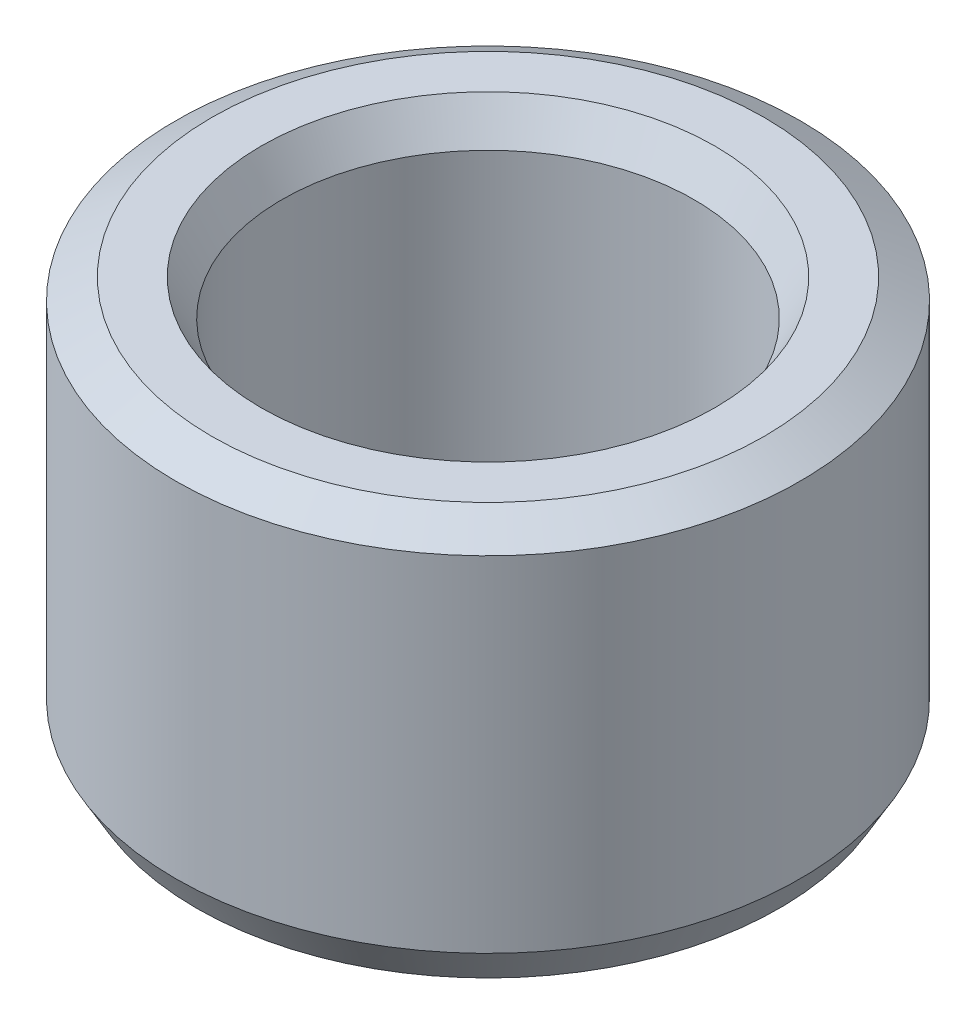
from build123d import *
from OCP.BRepFilletAPI import BRepFilletAPI_MakeChamfer

# Parameters (mm, degrees)
SKETCH1_R           = 10
BOSS_EXTRUDE1_DEPTH = 12.845973207
SKETCH2_R           = 6.598559423
CUT_EXTRUDE1_DEPTH  = 20.105471144
CHAMFER1_SIZE       = 0.665645347
CHAMFER1_SIZE2      = 1.15293156


with BuildPart() as part:
    # Sketch1 → Boss-Extrude1 (new body)
    with BuildSketch(Plane(origin=(0, 0, 0), x_dir=(1, 0, 0), z_dir=(0, 1, 0))):
        Circle(SKETCH1_R)
    extrude(amount=BOSS_EXTRUDE1_DEPTH)

    # Sketch2 → Cut-Extrude1 (cut, through all)
    with BuildSketch(Plane(origin=(0, 0, 0), x_dir=(1, 0, 0), z_dir=(0, 1, 0))):
        Circle(SKETCH2_R)
    extrude(amount=CUT_EXTRUDE1_DEPTH, mode=Mode.SUBTRACT)

    # Chamfer1: one chamfer whose edges measure the first distance from different faces: ONE call of the kernel's chamfer builder (chamfer() names one face for all edges)
    chamfer1_edges_1 = [part.edges().sort_by_distance(p)[0] for p in [
        (-6.598559423, 12.845973207, 0),
    ]]
    chamfer1_side_1 = [part.faces().sort_by_distance(p)[0] for p in [
        (-9.717157288, 12.845973207, 0),
    ]]
    chamfer1_edges_2 = [part.edges().sort_by_distance(p)[0] for p in [
        (-6.598559423, 0, 0),
    ]]
    chamfer1_side_2 = [part.faces().sort_by_distance(p)[0] for p in [
        (-6.598559423, 6.422986604, 0),
    ]]
    chamfer1_edges_3 = [part.edges().sort_by_distance(p)[0] for p in [
        (-10, 0, 0),
    ]]
    chamfer1_side_3 = [part.faces().sort_by_distance(p)[0] for p in [
        (-9.717157288, 0, 0),
    ]]
    chamfer1_edges_4 = [part.edges().sort_by_distance(p)[0] for p in [
        (-10, 12.845973207, 0),
    ]]
    chamfer1_side_4 = [part.faces().sort_by_distance(p)[0] for p in [
        (-10, 6.422986604, 0),
    ]]
    chamfer1 = BRepFilletAPI_MakeChamfer(part.part.solid().wrapped)
    for e in chamfer1_edges_1:
        chamfer1.Add(CHAMFER1_SIZE, CHAMFER1_SIZE2, e.wrapped, chamfer1_side_1[0].wrapped)  # the first distance lies on this face
    for e in chamfer1_edges_2:
        chamfer1.Add(CHAMFER1_SIZE, CHAMFER1_SIZE2, e.wrapped, chamfer1_side_2[0].wrapped)  # the first distance lies on this face
    for e in chamfer1_edges_3:
        chamfer1.Add(CHAMFER1_SIZE, CHAMFER1_SIZE2, e.wrapped, chamfer1_side_3[0].wrapped)  # the first distance lies on this face
    for e in chamfer1_edges_4:
        chamfer1.Add(CHAMFER1_SIZE, CHAMFER1_SIZE2, e.wrapped, chamfer1_side_4[0].wrapped)  # the first distance lies on this face
    add(Compound.cast(chamfer1.Shape()), mode=Mode.REPLACE)


solid = part.part
